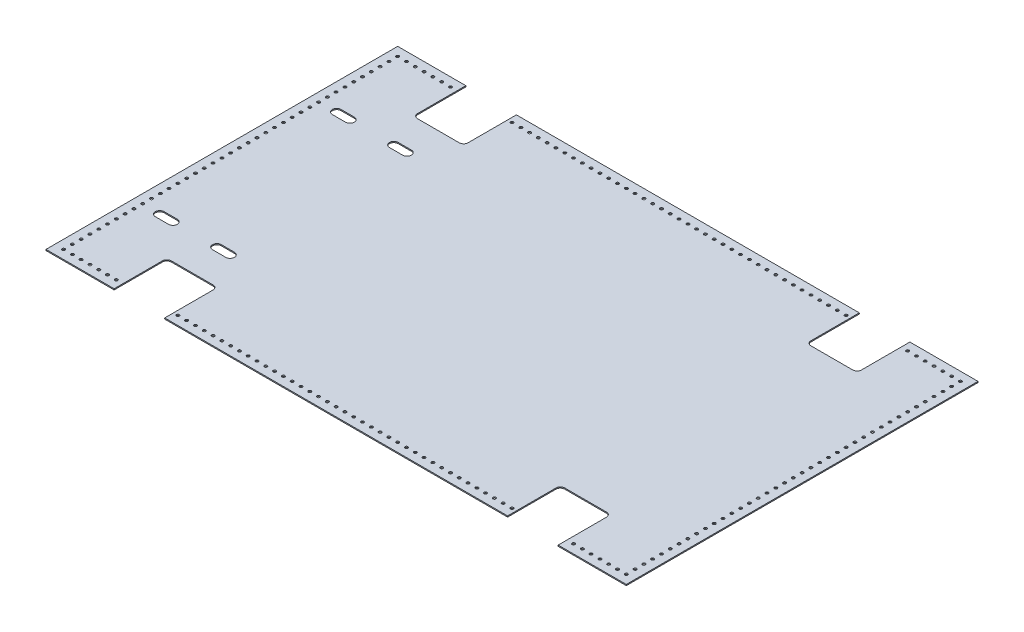
from build123d import *

# Parameters (mm, degrees)
SKETCH1_W               = 838.2
SKETCH1_H               = 508
BOSS_EXTRUDE1_DEPTH     = 0.79375
CUT_EXTRUDE1_DEPTH      = 491.064618348
CUT_EXTRUDE1_DEPTH_BACK = 491.064618348
CUT_EXTRUDE5_START      = -0.79375
CUT_EXTRUDE5_OUTLINE_R  = 2.0701
CUT_EXTRUDE5_DEPTH      = 1.5875
CUT_EXTRUDE6_DEPTH      = 491.062689907
CUT_EXTRUDE6_DEPTH_BACK = 491.062689907
SKETCH6_R               = 2.0701
CUT_EXTRUDE7_DEPTH      = 491.064618348
CUT_EXTRUDE7_DEPTH_BACK = 491.064618348


# Read off the part's stored shape, not the designer's step: Cut-Extrude5
with BuildPart() as part:
    # Sketch1 → Boss-Extrude1 (new, symmetric)
    with BuildSketch(Plane(origin=(0, 0, 0), x_dir=(1, 0, 0), z_dir=(0, 1, 0))):
        Rectangle(SKETCH1_W, SKETCH1_H)
    extrude(amount=BOSS_EXTRUDE1_DEPTH, both=True)

    # Sketch2 → Cut-Extrude1 (cut, two sides: drawn at the far end of the back side and taken through both)
    with BuildSketch(Plane(origin=(0, 0.79375, 0), x_dir=(1, 0, 0), z_dir=(0, 1, 0)).offset(-CUT_EXTRUDE1_DEPTH_BACK)):
        with BuildLine():
            Line((-320.675, 254), (-247.65, 254))
            Line((-247.65, 254), (-247.65, 184.15))
            ThreePointArc((-247.65, 184.15), (-249.509871939, 179.659871939), (-254, 177.8))
            Line((-254, 177.8), (-314.325, 177.8))
            ThreePointArc((-314.325, 177.8), (-318.815128061, 179.659871939), (-320.675, 184.15))
            Line((-320.675, 184.15), (-320.675, 254))
        make_face()
        with BuildLine():
            Line((247.65, 254), (247.65, 184.15))
            ThreePointArc((247.65, 184.15), (249.509871939, 179.659871939), (254, 177.8))
            Line((254, 177.8), (314.325, 177.8))
            ThreePointArc((314.325, 177.8), (318.815128061, 179.659871939), (320.675, 184.15))
            Line((320.675, 184.15), (320.675, 254))
            Line((320.675, 254), (247.65, 254))
        make_face()
        with BuildLine():
            Line((320.675, -254), (247.65, -254))
            Line((247.65, -254), (247.65, -184.15))
            ThreePointArc((247.65, -184.15), (249.509871939, -179.659871939), (254, -177.8))
            Line((254, -177.8), (314.325, -177.8))
            ThreePointArc((314.325, -177.8), (318.815128061, -179.659871939), (320.675, -184.15))
            Line((320.675, -184.15), (320.675, -254))
        make_face()
        with BuildLine():
            Line((-247.65, -254), (-247.65, -184.15))
            ThreePointArc((-247.65, -184.15), (-249.509871939, -179.659871939), (-254, -177.8))
            Line((-254, -177.8), (-314.325, -177.8))
            ThreePointArc((-314.325, -177.8), (-318.815128061, -179.659871939), (-320.675, -184.15))
            Line((-320.675, -184.15), (-320.675, -254))
            Line((-320.675, -254), (-247.65, -254))
        make_face()
    extrude(amount=CUT_EXTRUDE1_DEPTH + CUT_EXTRUDE1_DEPTH_BACK, mode=Mode.SUBTRACT)

    # Cut-Extrude5 outline → Cut-Extrude5 (cut)
    with BuildSketch(Plane(origin=(0, 0, 0), x_dir=(1, 0, 0), z_dir=(0, 1, 0)).offset(CUT_EXTRUDE5_START)):
        with Locations((228.6, -241.3)):
            Circle(CUT_EXTRUDE5_OUTLINE_R)
        with Locations((241.3, 241.3)):
            Circle(CUT_EXTRUDE5_OUTLINE_R)
        with Locations((228.6, 241.3)):
            Circle(CUT_EXTRUDE5_OUTLINE_R)
        with Locations((342.9, 241.3)):
            Circle(CUT_EXTRUDE5_OUTLINE_R)
        with Locations((368.3, 241.3)):
            Circle(CUT_EXTRUDE5_OUTLINE_R)
        with Locations((355.6, 241.3)):
            Circle(CUT_EXTRUDE5_OUTLINE_R)
        with Locations((330.2, 241.3)):
            Circle(CUT_EXTRUDE5_OUTLINE_R)
        with Locations((127, 241.3)):
            Circle(CUT_EXTRUDE5_OUTLINE_R)
        with Locations((114.3, 241.3)):
            Circle(CUT_EXTRUDE5_OUTLINE_R)
        with Locations((139.7, 241.3)):
            Circle(CUT_EXTRUDE5_OUTLINE_R)
        with Locations((88.9, 241.3)):
            Circle(CUT_EXTRUDE5_OUTLINE_R)
        with Locations((101.6, 241.3)):
            Circle(CUT_EXTRUDE5_OUTLINE_R)
        with Locations((203.2, 241.3)):
            Circle(CUT_EXTRUDE5_OUTLINE_R)
        with Locations((190.5, 241.3)):
            Circle(CUT_EXTRUDE5_OUTLINE_R)
        with Locations((215.9, 241.3)):
            Circle(CUT_EXTRUDE5_OUTLINE_R)
        with Locations((165.1, 241.3)):
            Circle(CUT_EXTRUDE5_OUTLINE_R)
        with Locations((152.4, 241.3)):
            Circle(CUT_EXTRUDE5_OUTLINE_R)
        with Locations((177.8, 241.3)):
            Circle(CUT_EXTRUDE5_OUTLINE_R)
        with Locations((381, 241.3)):
            Circle(CUT_EXTRUDE5_OUTLINE_R)
        with Locations((-393.7, 241.3)):
            Circle(CUT_EXTRUDE5_OUTLINE_R)
        with Locations((-381, 241.3)):
            Circle(CUT_EXTRUDE5_OUTLINE_R)
        with Locations((-368.3, 241.3)):
            Circle(CUT_EXTRUDE5_OUTLINE_R)
        with Locations((393.7, 241.3)):
            Circle(CUT_EXTRUDE5_OUTLINE_R)
        with Locations((-355.6, 241.3)):
            Circle(CUT_EXTRUDE5_OUTLINE_R)
        with Locations((-342.9, 241.3)):
            Circle(CUT_EXTRUDE5_OUTLINE_R)
        with Locations((-215.9, 241.3)):
            Circle(CUT_EXTRUDE5_OUTLINE_R)
        with Locations((-330.2, 241.3)):
            Circle(CUT_EXTRUDE5_OUTLINE_R)
        with Locations((-190.5, 241.3)):
            Circle(CUT_EXTRUDE5_OUTLINE_R)
        with Locations((-203.2, 241.3)):
            Circle(CUT_EXTRUDE5_OUTLINE_R)
        with Locations((-101.6, -241.3)):
            Circle(CUT_EXTRUDE5_OUTLINE_R)
        with Locations((-114.3, -241.3)):
            Circle(CUT_EXTRUDE5_OUTLINE_R)
        with Locations((-76.2, -241.3)):
            Circle(CUT_EXTRUDE5_OUTLINE_R)
        with Locations((-88.9, -241.3)):
            Circle(CUT_EXTRUDE5_OUTLINE_R)
        with Locations((-152.4, -241.3)):
            Circle(CUT_EXTRUDE5_OUTLINE_R)
        with Locations((-165.1, -241.3)):
            Circle(CUT_EXTRUDE5_OUTLINE_R)
        with Locations((-127, -241.3)):
            Circle(CUT_EXTRUDE5_OUTLINE_R)
        with Locations((-139.7, -241.3)):
            Circle(CUT_EXTRUDE5_OUTLINE_R)
        with Locations((0, -241.3)):
            Circle(CUT_EXTRUDE5_OUTLINE_R)
        with Locations((-12.7, -241.3)):
            Circle(CUT_EXTRUDE5_OUTLINE_R)
        with Locations((25.4, -241.3)):
            Circle(CUT_EXTRUDE5_OUTLINE_R)
        with Locations((12.7, -241.3)):
            Circle(CUT_EXTRUDE5_OUTLINE_R)
        with Locations((-50.8, -241.3)):
            Circle(CUT_EXTRUDE5_OUTLINE_R)
        with Locations((-63.5, -241.3)):
            Circle(CUT_EXTRUDE5_OUTLINE_R)
        with Locations((-25.4, -241.3)):
            Circle(CUT_EXTRUDE5_OUTLINE_R)
        with Locations((-38.1, -241.3)):
            Circle(CUT_EXTRUDE5_OUTLINE_R)
        with Locations((-203.2, -241.3)):
            Circle(CUT_EXTRUDE5_OUTLINE_R)
        with Locations((-215.9, -241.3)):
            Circle(CUT_EXTRUDE5_OUTLINE_R)
        with Locations((-177.8, -241.3)):
            Circle(CUT_EXTRUDE5_OUTLINE_R)
        with Locations((-190.5, -241.3)):
            Circle(CUT_EXTRUDE5_OUTLINE_R)
        with Locations((-241.3, -241.3)):
            Circle(CUT_EXTRUDE5_OUTLINE_R)
        with Locations((-228.6, -241.3)):
            Circle(CUT_EXTRUDE5_OUTLINE_R)
        with Locations((406.4, 25.4)):
            Circle(CUT_EXTRUDE5_OUTLINE_R)
        with Locations((406.4, 38.1)):
            Circle(CUT_EXTRUDE5_OUTLINE_R)
        with Locations((406.4, 50.8)):
            Circle(CUT_EXTRUDE5_OUTLINE_R)
        with Locations((406.4, 63.5)):
            Circle(CUT_EXTRUDE5_OUTLINE_R)
        with Locations((406.4, 76.2)):
            Circle(CUT_EXTRUDE5_OUTLINE_R)
        with Locations((406.4, 88.9)):
            Circle(CUT_EXTRUDE5_OUTLINE_R)
        with Locations((406.4, 101.6)):
            Circle(CUT_EXTRUDE5_OUTLINE_R)
        with Locations((406.4, 114.3)):
            Circle(CUT_EXTRUDE5_OUTLINE_R)
        with Locations((241.3, -241.3)):
            Circle(CUT_EXTRUDE5_OUTLINE_R)
        with Locations((406.4, 190.5)):
            Circle(CUT_EXTRUDE5_OUTLINE_R)
        with Locations((406.4, 177.8)):
            Circle(CUT_EXTRUDE5_OUTLINE_R)
        with Locations((406.4, 165.1)):
            Circle(CUT_EXTRUDE5_OUTLINE_R)
        with Locations((406.4, 152.4)):
            Circle(CUT_EXTRUDE5_OUTLINE_R)
        with Locations((406.4, 139.7)):
            Circle(CUT_EXTRUDE5_OUTLINE_R)
        with Locations((406.4, 127)):
            Circle(CUT_EXTRUDE5_OUTLINE_R)
        with Locations((406.4, 12.7)):
            Circle(CUT_EXTRUDE5_OUTLINE_R)
        with Locations((406.4, 0)):
            Circle(CUT_EXTRUDE5_OUTLINE_R)
        with Locations((406.4, -12.7)):
            Circle(CUT_EXTRUDE5_OUTLINE_R)
        with Locations((406.4, -25.4)):
            Circle(CUT_EXTRUDE5_OUTLINE_R)
        with Locations((406.4, -38.1)):
            Circle(CUT_EXTRUDE5_OUTLINE_R)
        with Locations((406.4, -50.8)):
            Circle(CUT_EXTRUDE5_OUTLINE_R)
        with Locations((406.4, -63.5)):
            Circle(CUT_EXTRUDE5_OUTLINE_R)
        with Locations((406.4, -76.2)):
            Circle(CUT_EXTRUDE5_OUTLINE_R)
        with Locations((406.4, -88.9)):
            Circle(CUT_EXTRUDE5_OUTLINE_R)
        with Locations((406.4, -101.6)):
            Circle(CUT_EXTRUDE5_OUTLINE_R)
        with Locations((406.4, -114.3)):
            Circle(CUT_EXTRUDE5_OUTLINE_R)
        with Locations((406.4, -127)):
            Circle(CUT_EXTRUDE5_OUTLINE_R)
        with Locations((406.4, -139.7)):
            Circle(CUT_EXTRUDE5_OUTLINE_R)
        with Locations((406.4, -152.4)):
            Circle(CUT_EXTRUDE5_OUTLINE_R)
        with Locations((406.4, -165.1)):
            Circle(CUT_EXTRUDE5_OUTLINE_R)
        with Locations((406.4, -177.8)):
            Circle(CUT_EXTRUDE5_OUTLINE_R)
        with Locations((101.6, -241.3)):
            Circle(CUT_EXTRUDE5_OUTLINE_R)
        with Locations((88.9, -241.3)):
            Circle(CUT_EXTRUDE5_OUTLINE_R)
        with Locations((127, -241.3)):
            Circle(CUT_EXTRUDE5_OUTLINE_R)
        with Locations((114.3, -241.3)):
            Circle(CUT_EXTRUDE5_OUTLINE_R)
        with Locations((50.8, -241.3)):
            Circle(CUT_EXTRUDE5_OUTLINE_R)
        with Locations((38.1, -241.3)):
            Circle(CUT_EXTRUDE5_OUTLINE_R)
        with Locations((76.2, -241.3)):
            Circle(CUT_EXTRUDE5_OUTLINE_R)
        with Locations((63.5, -241.3)):
            Circle(CUT_EXTRUDE5_OUTLINE_R)
        with Locations((203.2, -241.3)):
            Circle(CUT_EXTRUDE5_OUTLINE_R)
        with Locations((190.5, -241.3)):
            Circle(CUT_EXTRUDE5_OUTLINE_R)
        with Locations((215.9, -241.3)):
            Circle(CUT_EXTRUDE5_OUTLINE_R)
        with Locations((152.4, -241.3)):
            Circle(CUT_EXTRUDE5_OUTLINE_R)
        with Locations((139.7, -241.3)):
            Circle(CUT_EXTRUDE5_OUTLINE_R)
        with Locations((177.8, -241.3)):
            Circle(CUT_EXTRUDE5_OUTLINE_R)
        with Locations((165.1, -241.3)):
            Circle(CUT_EXTRUDE5_OUTLINE_R)
        with Locations((-241.3, 241.3)):
            Circle(CUT_EXTRUDE5_OUTLINE_R)
        with Locations((-406.4, -177.8)):
            Circle(CUT_EXTRUDE5_OUTLINE_R)
        with Locations((-406.4, -165.1)):
            Circle(CUT_EXTRUDE5_OUTLINE_R)
        with Locations((-406.4, -152.4)):
            Circle(CUT_EXTRUDE5_OUTLINE_R)
        with Locations((-406.4, -139.7)):
            Circle(CUT_EXTRUDE5_OUTLINE_R)
        with Locations((-406.4, -127)):
            Circle(CUT_EXTRUDE5_OUTLINE_R)
        with Locations((-406.4, -114.3)):
            Circle(CUT_EXTRUDE5_OUTLINE_R)
        with Locations((-406.4, -101.6)):
            Circle(CUT_EXTRUDE5_OUTLINE_R)
        with Locations((-406.4, -88.9)):
            Circle(CUT_EXTRUDE5_OUTLINE_R)
        with Locations((-406.4, -76.2)):
            Circle(CUT_EXTRUDE5_OUTLINE_R)
        with Locations((-406.4, -63.5)):
            Circle(CUT_EXTRUDE5_OUTLINE_R)
        with Locations((-406.4, -50.8)):
            Circle(CUT_EXTRUDE5_OUTLINE_R)
        with Locations((-406.4, -38.1)):
            Circle(CUT_EXTRUDE5_OUTLINE_R)
        with Locations((-406.4, -25.4)):
            Circle(CUT_EXTRUDE5_OUTLINE_R)
        with Locations((-406.4, -12.7)):
            Circle(CUT_EXTRUDE5_OUTLINE_R)
        with Locations((-406.4, 0)):
            Circle(CUT_EXTRUDE5_OUTLINE_R)
        with Locations((-406.4, 12.7)):
            Circle(CUT_EXTRUDE5_OUTLINE_R)
        with Locations((-406.4, 127)):
            Circle(CUT_EXTRUDE5_OUTLINE_R)
        with Locations((-406.4, 139.7)):
            Circle(CUT_EXTRUDE5_OUTLINE_R)
        with Locations((-406.4, 152.4)):
            Circle(CUT_EXTRUDE5_OUTLINE_R)
        with Locations((-406.4, 165.1)):
            Circle(CUT_EXTRUDE5_OUTLINE_R)
        with Locations((-406.4, 177.8)):
            Circle(CUT_EXTRUDE5_OUTLINE_R)
        with Locations((-406.4, 190.5)):
            Circle(CUT_EXTRUDE5_OUTLINE_R)
        with Locations((-406.4, 114.3)):
            Circle(CUT_EXTRUDE5_OUTLINE_R)
        with Locations((-406.4, 101.6)):
            Circle(CUT_EXTRUDE5_OUTLINE_R)
        with Locations((-406.4, 88.9)):
            Circle(CUT_EXTRUDE5_OUTLINE_R)
        with Locations((-406.4, 76.2)):
            Circle(CUT_EXTRUDE5_OUTLINE_R)
        with Locations((-406.4, 63.5)):
            Circle(CUT_EXTRUDE5_OUTLINE_R)
        with Locations((-406.4, 50.8)):
            Circle(CUT_EXTRUDE5_OUTLINE_R)
        with Locations((-406.4, 38.1)):
            Circle(CUT_EXTRUDE5_OUTLINE_R)
        with Locations((-406.4, 25.4)):
            Circle(CUT_EXTRUDE5_OUTLINE_R)
        with Locations((-393.7, -241.3)):
            Circle(CUT_EXTRUDE5_OUTLINE_R)
        with Locations((-228.6, 241.3)):
            Circle(CUT_EXTRUDE5_OUTLINE_R)
        with Locations((393.7, -241.3)):
            Circle(CUT_EXTRUDE5_OUTLINE_R)
        with Locations((381, -241.3)):
            Circle(CUT_EXTRUDE5_OUTLINE_R)
        with Locations((368.3, -241.3)):
            Circle(CUT_EXTRUDE5_OUTLINE_R)
        with Locations((355.6, -241.3)):
            Circle(CUT_EXTRUDE5_OUTLINE_R)
        with Locations((342.9, -241.3)):
            Circle(CUT_EXTRUDE5_OUTLINE_R)
        with Locations((330.2, -241.3)):
            Circle(CUT_EXTRUDE5_OUTLINE_R)
        with Locations((-342.9, -241.3)):
            Circle(CUT_EXTRUDE5_OUTLINE_R)
        with Locations((-355.6, -241.3)):
            Circle(CUT_EXTRUDE5_OUTLINE_R)
        with Locations((-330.2, -241.3)):
            Circle(CUT_EXTRUDE5_OUTLINE_R)
        with Locations((-381, -241.3)):
            Circle(CUT_EXTRUDE5_OUTLINE_R)
        with Locations((-368.3, -241.3)):
            Circle(CUT_EXTRUDE5_OUTLINE_R)
        with Locations((-114.3, 241.3)):
            Circle(CUT_EXTRUDE5_OUTLINE_R)
        with Locations((-127, 241.3)):
            Circle(CUT_EXTRUDE5_OUTLINE_R)
        with Locations((-88.9, 241.3)):
            Circle(CUT_EXTRUDE5_OUTLINE_R)
        with Locations((-76.2, 241.3)):
            Circle(CUT_EXTRUDE5_OUTLINE_R)
        with Locations((-101.6, 241.3)):
            Circle(CUT_EXTRUDE5_OUTLINE_R)
        with Locations((-139.7, 241.3)):
            Circle(CUT_EXTRUDE5_OUTLINE_R)
        with Locations((25.4, 241.3)):
            Circle(CUT_EXTRUDE5_OUTLINE_R)
        with Locations((38.1, 241.3)):
            Circle(CUT_EXTRUDE5_OUTLINE_R)
        with Locations((12.7, 241.3)):
            Circle(CUT_EXTRUDE5_OUTLINE_R)
        with Locations((63.5, 241.3)):
            Circle(CUT_EXTRUDE5_OUTLINE_R)
        with Locations((76.2, 241.3)):
            Circle(CUT_EXTRUDE5_OUTLINE_R)
        with Locations((50.8, 241.3)):
            Circle(CUT_EXTRUDE5_OUTLINE_R)
        with Locations((-50.8, 241.3)):
            Circle(CUT_EXTRUDE5_OUTLINE_R)
        with Locations((-38.1, 241.3)):
            Circle(CUT_EXTRUDE5_OUTLINE_R)
        with Locations((-63.5, 241.3)):
            Circle(CUT_EXTRUDE5_OUTLINE_R)
        with Locations((-12.7, 241.3)):
            Circle(CUT_EXTRUDE5_OUTLINE_R)
        with Locations((0, 241.3)):
            Circle(CUT_EXTRUDE5_OUTLINE_R)
        with Locations((-25.4, 241.3)):
            Circle(CUT_EXTRUDE5_OUTLINE_R)
        with Locations((-177.8, 241.3)):
            Circle(CUT_EXTRUDE5_OUTLINE_R)
        with Locations((-152.4, 241.3)):
            Circle(CUT_EXTRUDE5_OUTLINE_R)
        with Locations((-165.1, 241.3)):
            Circle(CUT_EXTRUDE5_OUTLINE_R)
    extrude(amount=CUT_EXTRUDE5_DEPTH, mode=Mode.SUBTRACT)

    # Sketch6 → Cut-Extrude6 (cut, two sides: drawn at the far end of the back side and taken through both)
    with BuildSketch(Plane(origin=(0, 0, 0), x_dir=(1, 0, 0), z_dir=(0, 1, 0)).offset(-CUT_EXTRUDE6_DEPTH_BACK)):
        with Locations(Location((406.4, -241.3, 0), (0, 0, 270))):
            Circle(SKETCH6_R)
        with Locations(Location((406.4, -228.6, 0), (0, 0, 270))):
            Circle(SKETCH6_R)
        with Locations(Location((406.4, -215.9, 0), (0, 0, 270))):
            Circle(SKETCH6_R)
        with Locations(Location((406.4, -203.2, 0), (0, 0, 270))):
            Circle(SKETCH6_R)
        with Locations(Location((406.4, -190.5, 0), (0, 0, 270))):
            Circle(SKETCH6_R)
        with Locations(Location((406.4, 190.5, 0), (0, 0, 270))):
            Circle(SKETCH6_R)
        with Locations(Location((406.4, 203.2, 0), (0, 0, 90))):
            Circle(SKETCH6_R)
        with Locations(Location((406.4, 215.9, 0), (0, 0, 90))):
            Circle(SKETCH6_R)
        with Locations(Location((406.4, 228.6, 0), (0, 0, 90))):
            Circle(SKETCH6_R)
        with Locations(Location((406.4, 241.3, 0), (0, 0, 90))):
            Circle(SKETCH6_R)
        with Locations(Location((-406.4, 241.3, 0), (0, 0, 270))):
            Circle(SKETCH6_R)
        with Locations(Location((-406.4, 228.6, 0), (0, 0, 270))):
            Circle(SKETCH6_R)
        with Locations(Location((-406.4, 215.9, 0), (0, 0, 270))):
            Circle(SKETCH6_R)
        with Locations(Location((-406.4, 203.2, 0), (0, 0, 270))):
            Circle(SKETCH6_R)
        with Locations(Location((-406.4, 190.5, 0), (0, 0, 270))):
            Circle(SKETCH6_R)
        with Locations(Location((-406.4, -190.5, 0), (0, 0, 90))):
            Circle(SKETCH6_R)
        with Locations(Location((-406.4, -203.2, 0), (0, 0, 90))):
            Circle(SKETCH6_R)
        with Locations(Location((-406.4, -215.9, 0), (0, 0, 90))):
            Circle(SKETCH6_R)
        with Locations(Location((-406.4, -228.6, 0), (0, 0, 90))):
            Circle(SKETCH6_R)
        with Locations(Location((-406.4, -241.3, 0), (0, 0, 90))):
            Circle(SKETCH6_R)
    extrude(amount=CUT_EXTRUDE6_DEPTH + CUT_EXTRUDE6_DEPTH_BACK, mode=Mode.SUBTRACT)

    # Sketch7 → Cut-Extrude7 (cut, two sides: drawn at the far end of the back side and taken through both)
    with BuildSketch(Plane(origin=(0, 0.79375, 0), x_dir=(1, 0, 0), z_dir=(0, 1, 0)).offset(-CUT_EXTRUDE7_DEPTH_BACK)):
        with BuildLine():
            Line((-381, 134.14502), (-361.95, 134.14502))
            ThreePointArc((-361.95, 134.14502), (-355.6, 127.79502), (-361.95, 121.44502))
            Line((-361.95, 121.44502), (-381, 121.44502))
            ThreePointArc((-381, 121.44502), (-387.35, 127.79502), (-381, 134.14502))
        make_face()
        with BuildLine():
            Line((-279.4, -134.14502), (-298.45, -134.14502))
            ThreePointArc((-298.45, -134.14502), (-304.8, -127.79502), (-298.45, -121.44502))
            Line((-298.45, -121.44502), (-279.4, -121.44502))
            ThreePointArc((-279.4, -121.44502), (-273.05, -127.79502), (-279.4, -134.14502))
        make_face()
        with BuildLine():
            Line((-279.4, 134.14502), (-298.45, 134.14502))
            ThreePointArc((-298.45, 134.14502), (-304.8, 127.79502), (-298.45, 121.44502))
            Line((-298.45, 121.44502), (-279.4, 121.44502))
            ThreePointArc((-279.4, 121.44502), (-273.05, 127.79502), (-279.4, 134.14502))
        make_face()
        with BuildLine():
            Line((-381, -134.14502), (-361.95, -134.14502))
            ThreePointArc((-361.95, -134.14502), (-355.6, -127.79502), (-361.95, -121.44502))
            Line((-361.95, -121.44502), (-381, -121.44502))
            ThreePointArc((-381, -121.44502), (-387.35, -127.79502), (-381, -134.14502))
        make_face()
    extrude(amount=CUT_EXTRUDE7_DEPTH + CUT_EXTRUDE7_DEPTH_BACK, mode=Mode.SUBTRACT)


solid = part.part
